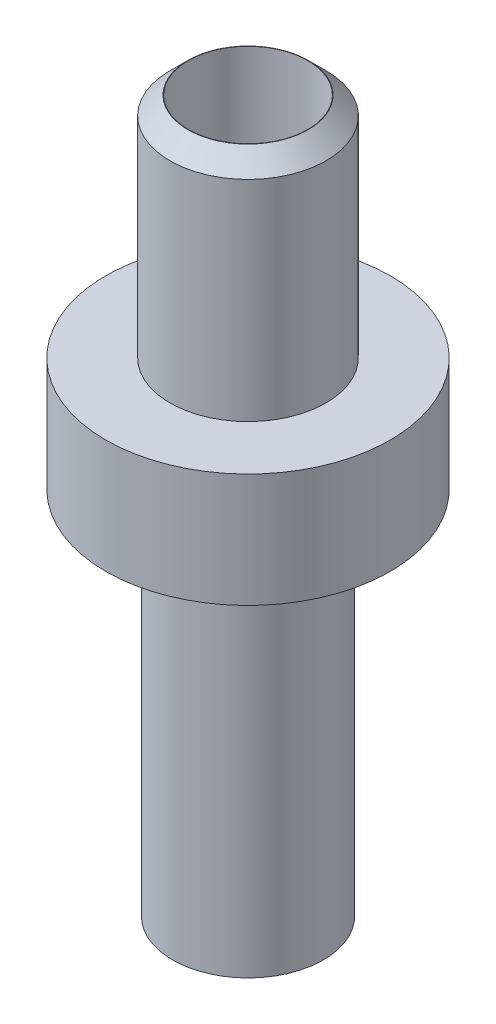
from build123d import *

# Parameters (mm, degrees)
SKETCH3_R          = 2.098913331
CUT_EXTRUDE1_DEPTH = 60


# Read off the part's stored shape, not the designer's step: #12-24 Machine Threads Stud1
with BuildPart() as part:
    # Sketch2 → Revolve1 (revolve)
    with BuildSketch(Plane.XY, mode=Mode.PRIVATE) as revolve1_sk:
        Polygon((0, 0), (0, 25), (-3.15, 25), (-3.15, 17), (-5, 17), (-5, 13), (-2.65, 13), (-2.65, 0), align=None)
    revolve(revolve1_sk.sketch.rotate(Axis((0, 0, 0), (0, 1, 0)), 270), axis=Axis((0, 0, 0), (0, 1, 0)))

    # Sketch3 → Cut-Extrude1 (cut)
    with BuildSketch(Plane(origin=(0, 25, 0), x_dir=(1, 0, 0), z_dir=(0, 1, 0))):
        with Locations(Location((0, 0, 0), (0, 0, 270))):
            Circle(SKETCH3_R)
    extrude(amount=-CUT_EXTRUDE1_DEPTH, mode=Mode.SUBTRACT)

    # #12-24 Machine Threads Stud1 outline → #12-24 Machine Threads Stud1 (revolve, cut)
    with BuildSketch(Plane.XY):
        Polygon((2.7432, 24.37008), (2.7432, 17), (3.15, 17), (3.15, 25), (2.11328, 25), align=None)
    revolve(axis=Axis((0, 0, 0), (0, 1, 0)), mode=Mode.SUBTRACT)


solid = part.part
